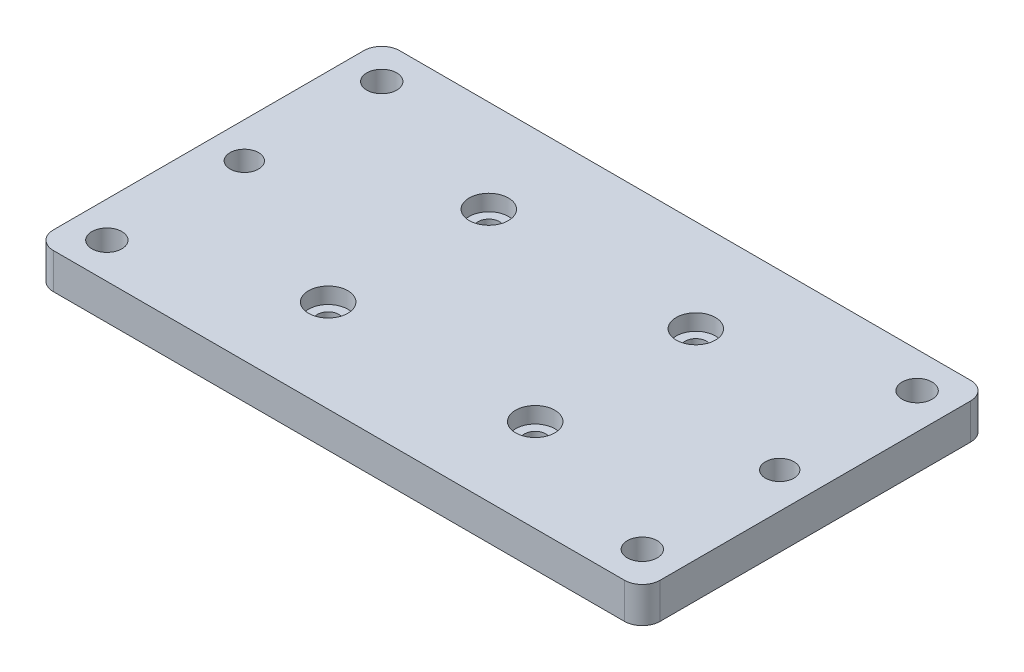
from build123d import *

# Parameters (mm, degrees)
SKETCH1_W                          = 170
SKETCH1_H                          = 97
BOSS_EXTRUDE1_DEPTH                = 10
FILLET1_R                          = 5
F_11_0_START                       = -10
F_11_0_11_DIAMETER_HOLE1_OUTLINE_R = 3
F_11_0_11_DIAMETER_HOLE1_DEPTH     = 10
SKETCH7_R                          = 5.5
CUT_EXTRUDE1_DEPTH                 = 4.5
M8_CLEARANCE_HOLE1_D               = 8.4
F_8_0MM_DOWEL_HOLE1_D              = 8


# Read off the part's stored shape, not the designer's step: Ø11.0 (11) Diameter Hole1
with BuildPart() as part:
    # Sketch1 → Boss-Extrude1 (new body)
    with BuildSketch(Plane(origin=(0, 0, 0), x_dir=(1, 0, 0), z_dir=(0, 1, 0))):
        Rectangle(SKETCH1_W, SKETCH1_H)
    extrude(amount=-BOSS_EXTRUDE1_DEPTH)

    # Fillet1
    fillet1_edges = [part.edges().sort_by_distance(p)[0] for p in [
        (85, -5, 48.5),
        (-85, -5, 48.5),
        (-85, -5, -48.5),
        (85, -5, -48.5),
    ]]
    fillet(fillet1_edges, radius=FILLET1_R)

    # Ø11.0 (11) Diameter Hole1 outline → Ø11.0 (11) Diameter Hole1 (cut)
    with BuildSketch(Plane(origin=(0, 0, 0), x_dir=(1, 0, 0), z_dir=(0, 1, 0)).offset(F_11_0_START)):
        with Locations((29, -22.5)):
            Circle(F_11_0_11_DIAMETER_HOLE1_OUTLINE_R)
        with Locations((-29, 22.5)):
            Circle(F_11_0_11_DIAMETER_HOLE1_OUTLINE_R)
        with Locations((-29, -22.5)):
            Circle(F_11_0_11_DIAMETER_HOLE1_OUTLINE_R)
        with Locations((29, 22.5)):
            Circle(F_11_0_11_DIAMETER_HOLE1_OUTLINE_R)
    extrude(amount=F_11_0_11_DIAMETER_HOLE1_DEPTH, mode=Mode.SUBTRACT)

    # Sketch7 → Cut-Extrude1 (cut)
    with BuildSketch(Plane(origin=(0, 0, 0), x_dir=(1, 0, 0), z_dir=(0, 1, 0))):
        with Locations(Location((-29, 22.5, 0), (0, 0, 270))):
            Circle(SKETCH7_R)
        with Locations(Location((29, 22.5, 0), (0, 0, 270))):
            Circle(SKETCH7_R)
        with Locations(Location((29, -22.5, 0), (0, 0, 270))):
            Circle(SKETCH7_R)
        with Locations(Location((-29, -22.5, 0), (0, 0, 270))):
            Circle(SKETCH7_R)
    extrude(amount=-CUT_EXTRUDE1_DEPTH, mode=Mode.SUBTRACT)

    # M8 Clearance Hole1 (through all)
    with Locations(Plane(origin=(0, 0, 0), x_dir=(1, 0, 0), z_dir=(0, 1, 0))):
        with Locations((-75, -38.5), (-75, 38.5), (75, -38.5), (75, 38.5)):
            Hole(M8_CLEARANCE_HOLE1_D / 2)

    # Ø8.0mm Dowel Hole1 (through all)
    with Locations(Plane(origin=(0, 0, 0), x_dir=(1, 0, 0), z_dir=(0, 1, 0))):
        with Locations((-75, 0), (75, 0)):
            Hole(F_8_0MM_DOWEL_HOLE1_D / 2)


solid = part.part
